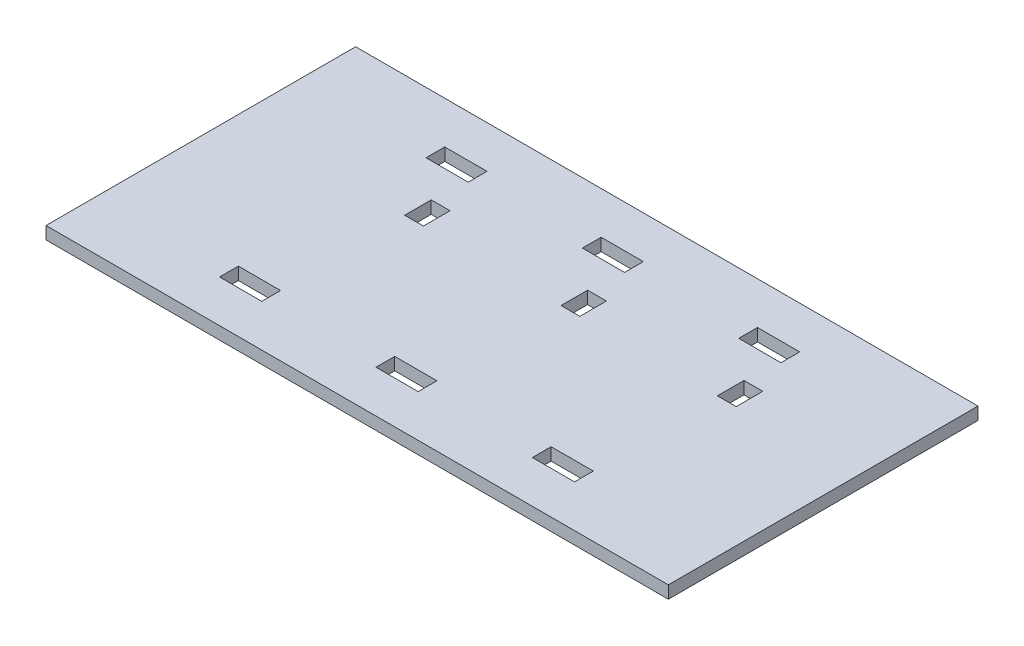
from build123d import *

# Parameters (mm, degrees)
SKETCH1_W                 = 101.092
SKETCH1_H                 = 50.292
BOSS_EXTRUDE1_DEPTH       = 2.032
SKETCH2_W                 = 3.048
SKETCH2_H                 = 4.318
WIRE_HOLE_DEPTH           = 57.492021171
SKETCH3_W                 = 6.858
SKETCH3_H                 = 3.048
CUT_EXTRUDE2_DEPTH        = 57.492021171
LPATTERN1_COUNT           = 2
LPATTERN1_PITCH           = 25.4
LPATTERN1_COUNT_DIR2      = 2
LPATTERN1_PITCH_DIR2      = 25.4
LPATTERN1_COPY_1_SKETCH_W = 6.858
LPATTERN1_COPY_1_SKETCH_H = 3.048
LPATTERN1_COPY_1_DEPTH    = 57.492021171
LPATTERN1_COPY_2_SKETCH_W = 6.858
LPATTERN1_COPY_2_SKETCH_H = 3.048
LPATTERN1_COPY_2_DEPTH    = 57.492021171
LPATTERN1_COPY_3_SKETCH_W = 6.858
LPATTERN1_COPY_3_SKETCH_H = 3.048
LPATTERN1_COPY_3_DEPTH    = 57.492021171


with BuildPart() as part:
    # Sketch1 → Boss-Extrude1 (new body)
    with BuildSketch(Plane(origin=(0, 0, 0), x_dir=(1, 0, 0), z_dir=(0, 1, 0))):
        Rectangle(SKETCH1_W, SKETCH1_H)
    extrude(amount=BOSS_EXTRUDE1_DEPTH)

    # Sketch2 → Wire Hole (cut, through all)
    with BuildSketch(Plane(origin=(0, 2.032, 0), x_dir=(1, 0, 0), z_dir=(0, 1, 0))):
        with Locations((4.064, 7.584002246)):
            Rectangle(SKETCH2_W, SKETCH2_H)
    wire_hole = extrude(amount=-WIRE_HOLE_DEPTH, mode=Mode.SUBTRACT)

    # Sketch3 → Cut-Extrude2 (cut, through all)
    with BuildSketch(Plane(origin=(0, 2.032, 0), x_dir=(1, 0, 0), z_dir=(0, 1, 0))):
        with Locations((-0.381, 16.764)):
            Rectangle(SKETCH3_W, SKETCH3_H)
    cut_extrude2 = extrude(amount=-CUT_EXTRUDE2_DEPTH, mode=Mode.SUBTRACT)

    # Mirror1: Cut-Extrude2 across plane
    add(cut_extrude2.mirror(Plane.XY), mode=Mode.SUBTRACT)

    # LPattern1: Wire Hole, Cut-Extrude2 2 × 2
    with Locations(*[Vector(-1, 0, 0) * (i * LPATTERN1_PITCH) + Vector(1, 0, 0) * (j * LPATTERN1_PITCH_DIR2) for i in range(LPATTERN1_COUNT) for j in range(LPATTERN1_COUNT_DIR2) if (i, j) != (0, 0)]):
        add(wire_hole, mode=Mode.SUBTRACT)
        add(cut_extrude2, mode=Mode.SUBTRACT)

    # LPattern1 copy 1 sketch → LPattern1 copy 1 (cut, through all)
    with BuildSketch(Plane(origin=(25.4, 2.032, 0), x_dir=(1, 0, 0), z_dir=(0, 1, 0))):
        with Locations((-0.381, -16.764)):
            Rectangle(LPATTERN1_COPY_1_SKETCH_W, LPATTERN1_COPY_1_SKETCH_H)
    extrude(amount=-LPATTERN1_COPY_1_DEPTH, mode=Mode.SUBTRACT)

    # LPattern1 copy 2 sketch → LPattern1 copy 2 (cut, through all)
    with BuildSketch(Plane(origin=(-25.4, 2.032, 0), x_dir=(1, 0, 0), z_dir=(0, 1, 0))):
        with Locations((-0.381, -16.764)):
            Rectangle(LPATTERN1_COPY_2_SKETCH_W, LPATTERN1_COPY_2_SKETCH_H)
    extrude(amount=-LPATTERN1_COPY_2_DEPTH, mode=Mode.SUBTRACT)

    # LPattern1 copy 3 sketch → LPattern1 copy 3 (cut, through all)
    with BuildSketch(Plane(origin=(0, 2.032, 0), x_dir=(1, 0, 0), z_dir=(0, 1, 0))):
        with Locations((-0.381, -16.764)):
            Rectangle(LPATTERN1_COPY_3_SKETCH_W, LPATTERN1_COPY_3_SKETCH_H)
    extrude(amount=-LPATTERN1_COPY_3_DEPTH, mode=Mode.SUBTRACT)


solid = part.part
